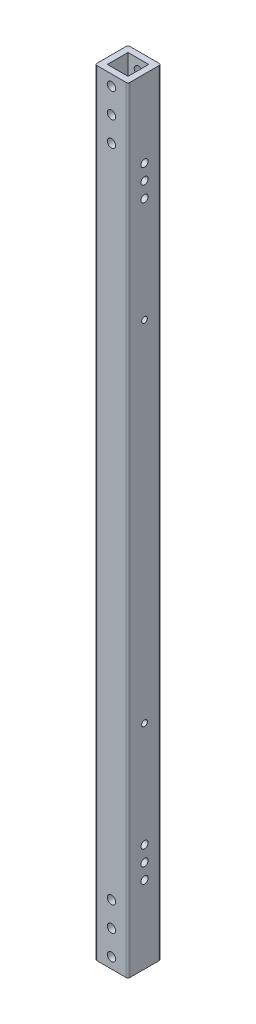
from build123d import *

# Parameters (mm, degrees)
SKETCH1_W                   = 25.4
SKETCH1_H                   = 25.4
SKETCH1_W_2                 = 15.875
SKETCH1_H_2                 = 15.875
BOSS_EXTRUDE1_DEPTH         = 298
FILLET1_R                   = 1.5
F_1_4_0_25_DIAMETER_HOLE1_D = 6.35
SKETCH4_R                   = 2.2
SKETCH4_R_2                 = 2.75
CUT_EXTRUDE1_DEPTH          = 300.350045933


with BuildPart() as part:
    # Sketch1 → Boss-Extrude1 (new, symmetric)
    with BuildSketch(Plane(origin=(0, 0, 0), x_dir=(1, 0, 0), z_dir=(0, 1, 0))):
        Rectangle(SKETCH1_W, SKETCH1_H)
        Rectangle(SKETCH1_W_2, SKETCH1_H_2, mode=Mode.SUBTRACT)
    extrude(amount=BOSS_EXTRUDE1_DEPTH, both=True)

    # Fillet1
    fillet1_edges = [part.edges().sort_by_distance(p)[0] for p in [
        (-12.7, 0, -12.7),
        (12.7, 0, -12.7),
        (-12.7, 0, 12.7),
        (12.7, 0, 12.7),
    ]]
    fillet(fillet1_edges, radius=FILLET1_R)

    # 1/4 (0.25) Diameter Hole1 (through all)
    with Locations(Plane(origin=(0.011805537, 289.825, -12.7), x_dir=(-1, 0, 0), z_dir=(0, 0, -1))):
        with Locations((0, 0), (0, -19), (0, -38)):
            f_1_4_0_25_diameter_hole1 = Hole(F_1_4_0_25_DIAMETER_HOLE1_D / 2)

    # Mirror1: 1/4 (0.25) Diameter Hole1 across plane
    add(f_1_4_0_25_diameter_hole1.mirror(Plane.ZX), mode=Mode.SUBTRACT)

    # Sketch4 → Cut-Extrude1 (cut, through all)
    with BuildSketch(Plane.ZY.offset(12.7)):
        with Locations((0, 134.3)):
            Circle(SKETCH4_R)
        with Locations((0, -134.3)):
            Circle(SKETCH4_R)
        with Locations((0, 238.65)):
            Circle(SKETCH4_R_2)
        with Locations((0, 226.9)):
            Circle(SKETCH4_R_2)
        with Locations((0, 215.15)):
            Circle(SKETCH4_R_2)
        with Locations((0, -215.15)):
            Circle(SKETCH4_R_2)
        with Locations((0, -226.9)):
            Circle(SKETCH4_R_2)
        with Locations((0, -238.65)):
            Circle(SKETCH4_R_2)
    extrude(amount=-CUT_EXTRUDE1_DEPTH, mode=Mode.SUBTRACT)


solid = part.part
